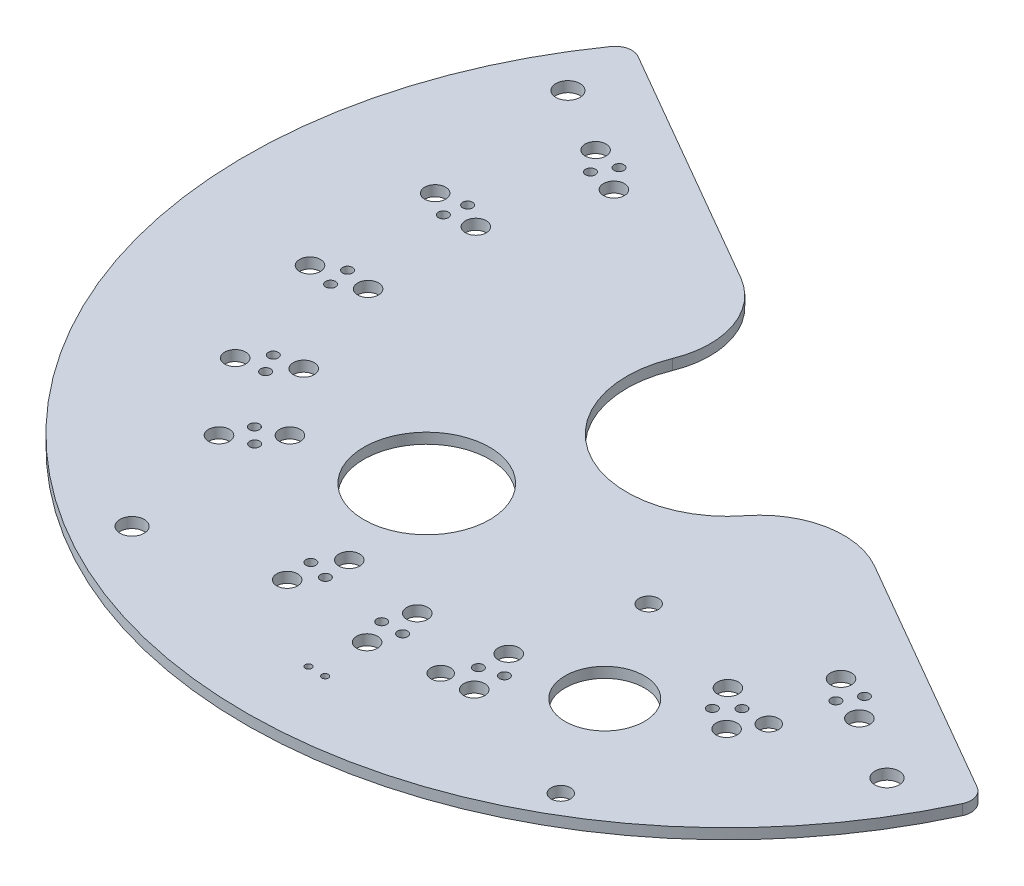
from build123d import *

# Parameters (mm, degrees)
SKETCH1_R           = 73.025
SKETCH1_R_2         = 15.24
SKETCH1_R_3         = 0.75
SKETCH1_R_4         = 1.585
SKETCH1_R_5         = 20
SKETCH1_R_6         = 9.525
SKETCH1_R_7         = 6
BOSS_EXTRUDE1_DEPTH = 1.5875
SKETCH2_R           = 1.8288
CUT_EXTRUDE1_DEPTH  = 104.285146107
CUT_EXTRUDE2_DEPTH  = 104.285146107
FILLET1_R           = 12.7
FILLET2_R           = 2.54
SKETCH4_R           = 0.4953
CUT_EXTRUDE3_DEPTH  = 104.285146107
SKETCH5_R           = 0.4953
SKETCH5_R_2         = 0.75
SKETCH5_R_3         = 0.750000002
SKETCH5_R_4         = 0.750000001
BOSS_EXTRUDE2_DEPTH = 0.1016
SKETCH6_R           = 1.4732
CUT_EXTRUDE4_DEPTH  = 104.285146107


with BuildPart() as part:
    # Sketch1 → Boss-Extrude1 (new body)
    with BuildSketch(Plane(origin=(0, 0, 0), x_dir=(1, 0, 0), z_dir=(0, 1, 0))):
        Circle(SKETCH1_R)
        Circle(SKETCH1_R_2, mode=Mode.SUBTRACT)
        with Locations((-1.585, 50.8)):
            Circle(SKETCH1_R_3, mode=Mode.SUBTRACT)
        with Locations((1.585, 50.8)):
            Circle(SKETCH1_R_3, mode=Mode.SUBTRACT)
        with Locations((0, 54.6)):
            Circle(SKETCH1_R_4, mode=Mode.SUBTRACT)
        with Locations((0, 47)):
            Circle(SKETCH1_R_4, mode=Mode.SUBTRACT)
        with Locations((47.284987047, 27.3)):
            Circle(SKETCH1_R_4, mode=Mode.SUBTRACT)
        with Locations((43.201590512, 26.772650265)):
            Circle(SKETCH1_R_3, mode=Mode.SUBTRACT)
        with Locations((44.786590512, 24.027349735)):
            Circle(SKETCH1_R_3, mode=Mode.SUBTRACT)
        with Locations((40.703193978, 23.5)):
            Circle(SKETCH1_R_4, mode=Mode.SUBTRACT)
        with Locations((47.284987047, -27.3)):
            Circle(SKETCH1_R_4, mode=Mode.SUBTRACT)
        with Locations((44.786590512, -24.027349735)):
            Circle(SKETCH1_R_3, mode=Mode.SUBTRACT)
        with Locations((43.201590512, -26.772650265)):
            Circle(SKETCH1_R_3, mode=Mode.SUBTRACT)
        with Locations((40.703193978, -23.5)):
            Circle(SKETCH1_R_4, mode=Mode.SUBTRACT)
        with Locations((0, -54.6)):
            Circle(SKETCH1_R_4, mode=Mode.SUBTRACT)
        with Locations((1.585, -50.8)):
            Circle(SKETCH1_R_3, mode=Mode.SUBTRACT)
        with Locations((-1.585, -50.8)):
            Circle(SKETCH1_R_3, mode=Mode.SUBTRACT)
        with Locations((0, -47)):
            Circle(SKETCH1_R_4, mode=Mode.SUBTRACT)
        with Locations((-47.284987047, -27.3)):
            Circle(SKETCH1_R_4, mode=Mode.SUBTRACT)
        with Locations((-43.201590512, -26.772650265)):
            Circle(SKETCH1_R_3, mode=Mode.SUBTRACT)
        with Locations((-44.786590512, -24.027349735)):
            Circle(SKETCH1_R_3, mode=Mode.SUBTRACT)
        with Locations((-40.703193978, -23.5)):
            Circle(SKETCH1_R_4, mode=Mode.SUBTRACT)
        with Locations((-47.284987047, 27.3)):
            Circle(SKETCH1_R_4, mode=Mode.SUBTRACT)
        with Locations((-44.786590512, 24.027349735)):
            Circle(SKETCH1_R_3, mode=Mode.SUBTRACT)
        with Locations((-43.201590512, 26.772650265)):
            Circle(SKETCH1_R_3, mode=Mode.SUBTRACT)
        with Locations((-40.703193978, 23.5)):
            Circle(SKETCH1_R_4, mode=Mode.SUBTRACT)
        with Locations((25.4, 43.994090512)):
            Circle(SKETCH1_R_5, mode=Mode.SUBTRACT)
        with Locations((-16.320688268, -29.242892178)):
            Circle(SKETCH1_R_6, mode=Mode.SUBTRACT)
        with Locations((25.4, -43.994090512)):
            Circle(SKETCH1_R_7, mode=Mode.SUBTRACT)
        with Locations((-46.285964392, 8.16146435)):
            Circle(SKETCH1_R_4, mode=Mode.SUBTRACT)
        with Locations((-50.303466215, 7.260407137)):
            Circle(SKETCH1_R_3, mode=Mode.SUBTRACT)
        with Locations((-49.753001491, 10.382247714)):
            Circle(SKETCH1_R_3, mode=Mode.SUBTRACT)
        with Locations((-53.770503314, 9.481190501)):
            Circle(SKETCH1_R_4, mode=Mode.SUBTRACT)
        with Locations((-46.285964392, -8.16146435)):
            Circle(SKETCH1_R_4, mode=Mode.SUBTRACT)
        with Locations((-49.753001491, -10.382247714)):
            Circle(SKETCH1_R_3, mode=Mode.SUBTRACT)
        with Locations((-50.303466215, -7.260407137)):
            Circle(SKETCH1_R_3, mode=Mode.SUBTRACT)
        with Locations((-53.770503314, -9.481190501)):
            Circle(SKETCH1_R_4, mode=Mode.SUBTRACT)
        with Locations((-34.540268185, -37.101507151)):
            Circle(SKETCH1_R_3, mode=Mode.SUBTRACT)
        with Locations((-36.799076534, -34.871722247)):
            Circle(SKETCH1_R_3, mode=Mode.SUBTRACT)
        with Locations((-38.370984134, -38.66907198)):
            Circle(SKETCH1_R_4, mode=Mode.SUBTRACT)
        with Locations((-32.986863365, -33.305169676)):
            Circle(SKETCH1_R_4, mode=Mode.SUBTRACT)
        with Locations((-14.730224252, -48.388224257)):
            Circle(SKETCH1_R_3, mode=Mode.SUBTRACT)
        with Locations((-11.673604783, -49.243346058)):
            Circle(SKETCH1_R_3, mode=Mode.SUBTRACT)
        with Locations((-12.1397751, -45.16003322)):
            Circle(SKETCH1_R_4, mode=Mode.SUBTRACT)
        with Locations((-14.248361791, -52.461681428)):
            Circle(SKETCH1_R_4, mode=Mode.SUBTRACT)
        with Locations((34.838579463, -37.125134571)):
            Circle(SKETCH1_R_3, mode=Mode.SUBTRACT)
        with Locations((37.107446401, -34.905585361)):
            Circle(SKETCH1_R_3, mode=Mode.SUBTRACT)
        with Locations((33.338108593, -33.267644279)):
            Circle(SKETCH1_R_4, mode=Mode.SUBTRACT)
        with Locations((38.607228085, -38.744558024)):
            Circle(SKETCH1_R_4, mode=Mode.SUBTRACT)
        with Locations((11.756179422, -49.493467435)):
            Circle(SKETCH1_R_3, mode=Mode.SUBTRACT)
        with Locations((14.801485259, -48.59889031)):
            Circle(SKETCH1_R_3, mode=Mode.SUBTRACT)
        with Locations((12.242324274, -45.383077263)):
            Circle(SKETCH1_R_4, mode=Mode.SUBTRACT)
        with Locations((14.323425392, -52.692606833)):
            Circle(SKETCH1_R_4, mode=Mode.SUBTRACT)
    extrude(amount=-BOSS_EXTRUDE1_DEPTH)

    # Sketch2 → Cut-Extrude1 (cut, through all)
    with BuildSketch(Plane(origin=(0, 0, 0), x_dir=(1, 0, 0), z_dir=(0, 1, 0))):
        with Locations((-57.192317666, 33.02)):
            Circle(SKETCH2_R)
        with Locations((33.02, 57.192317666)):
            Circle(SKETCH2_R)
        with Locations((57.192317666, -33.02)):
            Circle(SKETCH2_R)
        with Locations((-33.02, -57.192317666)):
            Circle(SKETCH2_R)
    extrude(amount=-CUT_EXTRUDE1_DEPTH, mode=Mode.SUBTRACT)

    # Sketch3 → Cut-Extrude2 (cut, through all)
    with BuildSketch(Plane(origin=(0, 0, 0), x_dir=(1, 0, 0), z_dir=(0, 1, 0))):
        with BuildLine():
            Line((-59.533825484, 44.637157955), (68.423825484, -29.239226276))
            ThreePointArc((68.423825484, -29.239226276), (37.204677955, 64.440392498), (-59.533825484, 44.637157955))
        make_face()
    extrude(amount=-CUT_EXTRUDE2_DEPTH, mode=Mode.SUBTRACT)

    # Fillet1
    fillet1_edges = [part.edges().sort_by_distance(p)[0] for p in [
        (15.165033815, -0.79375, -1.509751431),
        (-6.275033815, -0.79375, -13.888180249),
    ]]
    fillet(fillet1_edges, radius=FILLET1_R)

    # Fillet2
    fillet2_edges = [part.edges().sort_by_distance(p)[0] for p in [
        (67.216123088, -0.79375, 28.541958973),
        (-58.326123088, -0.79375, -43.939890652),
    ]]
    fillet(fillet2_edges, radius=FILLET2_R)

    # Sketch4 → Cut-Extrude3 (cut, through all)
    with BuildSketch(Plane(origin=(0, 0, 0), x_dir=(1, 0, 0), z_dir=(0, 1, 0))):
        with Locations((1.27, -62.23)):
            Circle(SKETCH4_R)
        with Locations((-1.27, -62.23)):
            Circle(SKETCH4_R)
    extrude(amount=-CUT_EXTRUDE3_DEPTH, mode=Mode.SUBTRACT)

    # Sketch5 → Boss-Extrude2 (add)
    # profile 1 of 5: a face of its own
    with BuildSketch(Plane.XZ.offset(1.5875)):
        with BuildLine():
            Line((34.421138413, 15.230954413), (45.118682479, 21.393363734))
            ThreePointArc((45.118682479, 21.393363734), (44.769120265, 22.107020542), (44.40823453, 22.815018613))
            ThreePointArc((44.40823453, 22.815018613), (44.117516595, 25.106812607), (46.040660767, 23.826830917))
            ThreePointArc((46.040660767, 23.826830917), (46.421042926, 23.076981801), (46.789213549, 22.321062045))
            Line((46.789213549, 22.321062045), (55.073498808, 27.103996369))
            ThreePointArc((55.073498808, 27.103996369), (32.96474327, 51.778785147), (1.252427599, 61.368952372))
            ThreePointArc((1.252427599, 61.368952372), (0.408952372, 62.247572401), (1.287572401, 63.091047628))
            ThreePointArc((1.287572401, 63.091047628), (34.697483613, 52.708849014), (57.44223396, 26.125234758))
            Line((57.44223396, 26.125234758), (28.012465947, 9.133950273))
            ThreePointArc((28.012465947, 9.133950273), (-9.966341124, 17.366115575), (-22.30608396, -19.483430947))
            Line((-22.30608396, -19.483430947), (-29.83516689, -23.556613805))
            Line((-29.83516689, -23.556613805), (-36.397117592, -27.130853686))
            Line((-36.397117592, -27.130853686), (-39.459709044, -21.521462671))
            ThreePointArc((-39.459709044, -21.521462671), (-43.38379222, -11.090113616), (-44.273580184, 0.01933053))
            Line((-44.273580184, 0.01933053), (-49.741799142, -0.051066078))
            ThreePointArc((-49.741799142, -0.051066078), (-49.648799952, -3.241386025), (-49.351982963, -6.419229617))
            ThreePointArc((-49.351982963, -6.419229617), (-50.166367123, -8.522985387), (-51.413325304, -6.643063794))
            ThreePointArc((-51.413325304, -6.643063794), (-51.840720629, -1e-09), (-51.413325304, 6.643063793))
            ThreePointArc((-51.413325304, 6.643063793), (-50.213533287, 8.52721891), (-49.291950751, 6.492464129))
            ThreePointArc((-49.291950751, 6.492464129), (-49.515885664, 4.551010959), (-49.663606075, 2.602276513))
            Line((-49.663606075, 2.602276513), (-41.994222134, 2.662628969))
            ThreePointArc((-41.994222134, 2.662628969), (-41.188139241, -10.59414945), (-36.50410532, -23.022012094))
            Line((-36.50410532, -23.022012094), (-35.928794568, -24.049843157))
            Line((-35.928794568, -24.049843157), (-31.053590427, -21.385433263))
            ThreePointArc((-31.053590427, -21.385433263), (-31.761936542, -19.017766992), (-30.06523382, -20.814652538))
            Line((-30.06523382, -20.814652538), (-29.551271602, -21.70398588))
            Line((-29.551271602, -21.70398588), (-25.045535575, -19.082790815))
            ThreePointArc((-25.045535575, -19.082790815), (-11.332801173, 19.577156333), (29.001504046, 12.108928915))
            Line((29.001504046, 12.108928915), (33.431303181, 14.660751587))
            ThreePointArc((33.431303181, 14.660751587), (33.105281576, 15.233598122), (32.771708155, 15.802080323))
            ThreePointArc((32.771708155, 15.802080323), (31.537563024, 17.918319695), (33.677676765, 16.72605443))
            ThreePointArc((33.677676765, 16.72605443), (34.055427476, 15.981497904), (34.421138413, 15.230954413))
        make_face()
        with Locations((1.27, 62.23)):
            Circle(SKETCH5_R, mode=Mode.SUBTRACT)
        with Locations((44.786590512, 24.027349735)):
            Circle(SKETCH5_R_2, mode=Mode.SUBTRACT)
        with Locations((-50.303466216, 7.260407137)):
            Circle(SKETCH5_R_3, mode=Mode.SUBTRACT)
        with Locations((-50.303466216, -7.260407137)):
            Circle(SKETCH5_R_4, mode=Mode.SUBTRACT)
        with Locations((-31.173750375, -20.038911028)):
            Circle(SKETCH5_R_2, mode=Mode.SUBTRACT)
        with Locations((32.507430232, 16.993318336)):
            Circle(SKETCH5_R_2, mode=Mode.SUBTRACT)
    # profile 2 of 5: a face of its own
    with BuildSketch(Plane.XZ.offset(1.5875)):
        with BuildLine():
            Line((-38.297056404, 31.601436292), (-48.291119924, 37.890429222))
            ThreePointArc((-48.291119924, 37.890429222), (-31.426224027, 52.72674211), (-10.35299305, 60.502334046))
            Line((-10.35299305, 60.502334046), (-8.088902279, 49.009011046))
            ThreePointArc((-8.088902279, 49.009011046), (-5.107568985, 49.41589346), (-2.107128339, 49.642294512))
            ThreePointArc((-2.107128339, 49.642294512), (-0.325590293, 50.963667925), (-2.385689518, 51.785797289))
            ThreePointArc((-2.385689518, 51.785797289), (-4.243581169, 51.66674302), (-6.096000003, 51.481055733))
            Line((-6.096000003, 51.481055733), (-7.591915656, 60.91042363))
            ThreePointArc((-7.591915656, 60.91042363), (-3.848968682, 61.260936413), (-0.091584425, 61.381662591))
            ThreePointArc((-0.091584425, 61.381662591), (0.181924196, 62.245992311), (-0.110556188, 63.104087909))
            ThreePointArc((-0.110556188, 63.104087909), (-54.764696314, 31.352291321), (-54.473795784, -31.855042086))
            ThreePointArc((-54.473795784, -31.855042086), (-46.806663491, -33.011734103), (-41.946969776, -26.969695456))
            ThreePointArc((-41.946969776, -26.969695456), (-43.838112799, -25.6736783), (-43.654971249, -27.958966373))
            ThreePointArc((-43.654971249, -27.958966373), (-48.583607028, -31.914469619), (-54.145324488, -28.913677147))
            ThreePointArc((-54.145324488, -28.913677147), (-61.217777916, 4.483364494), (-49.355131441, 36.493669185))
            Line((-49.355131441, 36.493669185), (-41.535902078, 31.019818729))
            ThreePointArc((-41.535902078, 31.019818729), (-42.622921402, 29.508420604), (-43.654971249, 27.958966373))
            ThreePointArc((-43.654971249, 27.958966373), (-43.997107924, 25.782674484), (-41.945489407, 26.585273605))
            ThreePointArc((-41.945489407, 26.585273605), (-40.199309174, 29.150113494), (-38.297056404, 31.601436292))
        make_face()
        with Locations((-1.27, 62.23)):
            Circle(SKETCH5_R, mode=Mode.SUBTRACT)
        with Locations((-1.585, 50.8)):
            Circle(SKETCH5_R_2, mode=Mode.SUBTRACT)
        with Locations((-43.201590512, 26.772650265)):
            Circle(SKETCH5_R_2, mode=Mode.SUBTRACT)
        with Locations((-43.201590512, -26.772650265)):
            Circle(SKETCH5_R_2, mode=Mode.SUBTRACT)
    # profile 3 of 5: a face of its own
    with BuildSketch(Plane.XZ.offset(1.5875)):
        with BuildLine():
            Line((33.336492384, 26.169869074), (41.535902076, 31.019818731))
            ThreePointArc((41.535902076, 31.019818731), (42.622921401, 29.508420605), (43.654971249, 27.958966372))
            ThreePointArc((43.654971249, 27.958966372), (43.816490528, 25.661435628), (41.955638766, 27.018626373))
            ThreePointArc((41.955638766, 27.018626373), (41.493001836, 27.716582617), (41.018715054, 28.40667529))
            Line((41.018715054, 28.40667529), (32.476569676, 23.819841654))
            ThreePointArc((32.476569676, 23.819841654), (19.965352292, 34.978524015), (3.994943482, 40.076836963))
            Line((3.994943482, 40.076836963), (3.994943482, 49.645894905))
            ThreePointArc((3.994943482, 49.645894905), (3.146190944, 49.704205903), (2.296568956, 49.748063871))
            ThreePointArc((2.296568956, 49.748063871), (0.316212865, 50.855490586), (2.385689518, 51.785797289))
            ThreePointArc((2.385689518, 51.785797289), (4.243581169, 51.66674302), (6.096000004, 51.481055733))
            Line((6.096000004, 51.481055733), (6.096000004, 41.940702852))
            ThreePointArc((6.096000004, 41.940702852), (21.234645358, 36.677971704), (33.336492384, 26.169869074))
        make_face()
        with Locations((1.585, 50.8)):
            Circle(SKETCH5_R_2, mode=Mode.SUBTRACT)
        with Locations((43.201590512, 26.772650265)):
            Circle(SKETCH5_R_2, mode=Mode.SUBTRACT)
    # profile 4 of 5: a face of its own
    with BuildSketch(Plane.XZ.offset(1.5875)):
        with BuildLine():
            ThreePointArc((-48.584155636, -10.87893611), (-50.039357061, -9.144952079), (-50.584784029, -11.341954863))
            ThreePointArc((-50.584784029, -11.341954863), (-48.714342632, -17.7305707), (-46.040660767, -23.826830917))
            ThreePointArc((-46.040660767, -23.826830917), (-44.168256027, -25.136656935), (-44.297624827, -22.855252231))
            ThreePointArc((-44.297624827, -22.855252231), (-46.824176955, -17.004279122), (-48.584155636, -10.87893611))
        make_face()
        with Locations((-49.753001492, -10.382247714)):
            Circle(SKETCH5_R_4, mode=Mode.SUBTRACT)
        with Locations((-44.786590512, -24.027349735)):
            Circle(SKETCH5_R_2, mode=Mode.SUBTRACT)
    # profile 5 of 5: a face of its own
    with BuildSketch(Plane.XZ.offset(1.5875)):
        with BuildLine():
            ThreePointArc((-50.584784029, 11.341954863), (-50.115886812, 9.165196259), (-48.53146032, 10.729720249))
            ThreePointArc((-48.53146032, 10.729720249), (-46.676497106, 17.024562886), (-44.011303835, 23.021451844))
            ThreePointArc((-44.011303835, 23.021451844), (-44.31811715, 25.207787242), (-46.040660767, 23.826830917))
            ThreePointArc((-46.040660767, 23.826830917), (-46.86650257, 22.158322415), (-47.631902079, 20.461237003))
            ThreePointArc((-47.631902079, 20.461237003), (-49.319566951, 15.969991583), (-50.584784029, 11.341954863))
        make_face()
        with Locations((-44.786590512, 24.027349735)):
            Circle(SKETCH5_R_2, mode=Mode.SUBTRACT)
        with Locations((-49.753001493, 10.382247714)):
            Circle(SKETCH5_R_3, mode=Mode.SUBTRACT)
    extrude(amount=BOSS_EXTRUDE2_DEPTH)

    # Sketch6 → Cut-Extrude4 (cut, through all)
    with BuildSketch(Plane.XZ.offset(1.5875)):
        with Locations((34.496852839, 59.750301818)):
            Circle(SKETCH6_R)
        with Locations((9.643788694, 53.090943351)):
            Circle(SKETCH6_R)
        with Locations((16.303147161, 28.237879206)):
            Circle(SKETCH6_R)
        with Locations((41.156211306, 34.897237673)):
            Circle(SKETCH6_R)
    extrude(amount=-CUT_EXTRUDE4_DEPTH, mode=Mode.SUBTRACT)


solid = part.part
